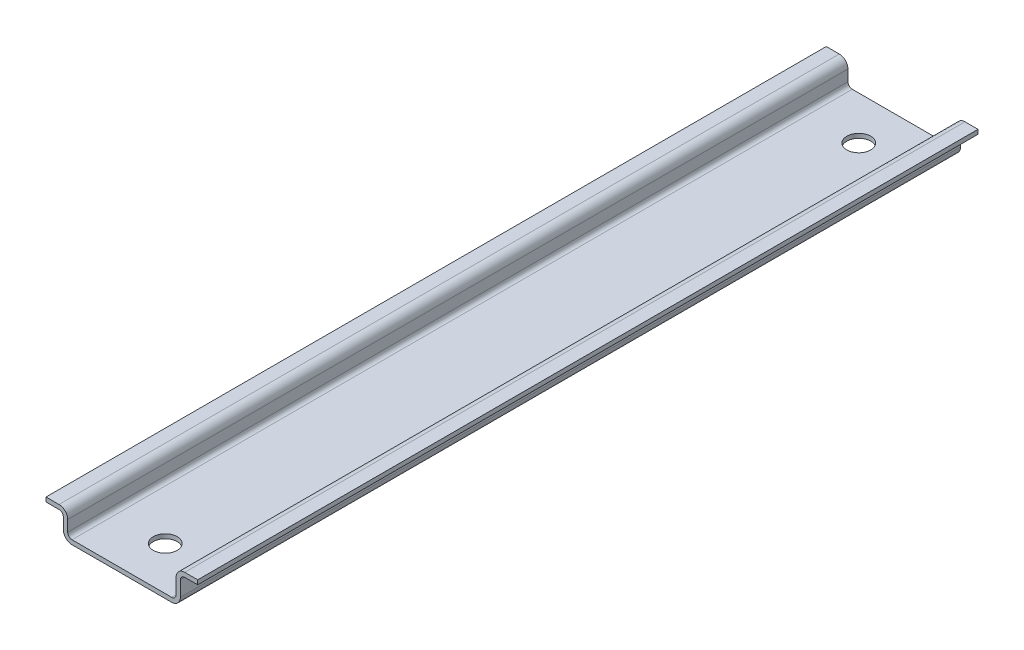
from build123d import *

# Parameters (mm, degrees)
BOSS_EXTRUDE1_DEPTH = 180
SKETCH2_R           = 2.75
CUT_EXTRUDE1_DEPTH  = 1


with BuildPart() as part:
    # Sketch1 → Boss-Extrude1 (new body)
    with BuildSketch(Plane.XY):
        with BuildLine():
            Line((2, 0), (25, 0))
            ThreePointArc((25, 0), (26.414213562, 0.585786438), (27, 2))
            Line((27, 2), (27, 5.5))
            ThreePointArc((27, 5.5), (27.292893219, 6.207106781), (28, 6.5))
            Line((28, 6.5), (31, 6.5))
            Line((31, 6.5), (31, 7.5))
            Line((31, 7.5), (28, 7.5))
            ThreePointArc((28, 7.5), (26.585786438, 6.914213562), (26, 5.5))
            Line((26, 5.5), (26, 2))
            ThreePointArc((26, 2), (25.707106781, 1.292893219), (25, 1))
            Line((25, 1), (2, 1))
            ThreePointArc((2, 1), (1.292893219, 1.292893219), (1, 2))
            Line((1, 2), (1, 4.544540718))
            ThreePointArc((1, 4.544540718), (0.414213562, 5.95875428), (-1, 6.544540718))
            Line((-1, 6.544540718), (-4, 6.544540718))
            Line((-4, 6.544540718), (-4, 5.544540718))
            Line((-4, 5.544540718), (-1, 5.544540718))
            ThreePointArc((-1, 5.544540718), (-0.292893219, 5.251647499), (0, 4.544540718))
            Line((0, 4.544540718), (0, 2))
            ThreePointArc((0, 2), (0.585786438, 0.585786438), (2, 0))
        make_face()
    extrude(amount=BOSS_EXTRUDE1_DEPTH)

    # Sketch2 → Cut-Extrude1 (cut)
    with BuildSketch(Plane(origin=(0, 1, 0), x_dir=(1, 0, 0), z_dir=(0, 1, 0))):
        with Locations((13.5, -10)):
            Circle(SKETCH2_R)
        with Locations((13.5, -170)):
            Circle(SKETCH2_R)
    extrude(amount=-CUT_EXTRUDE1_DEPTH, mode=Mode.SUBTRACT)


solid = part.part
